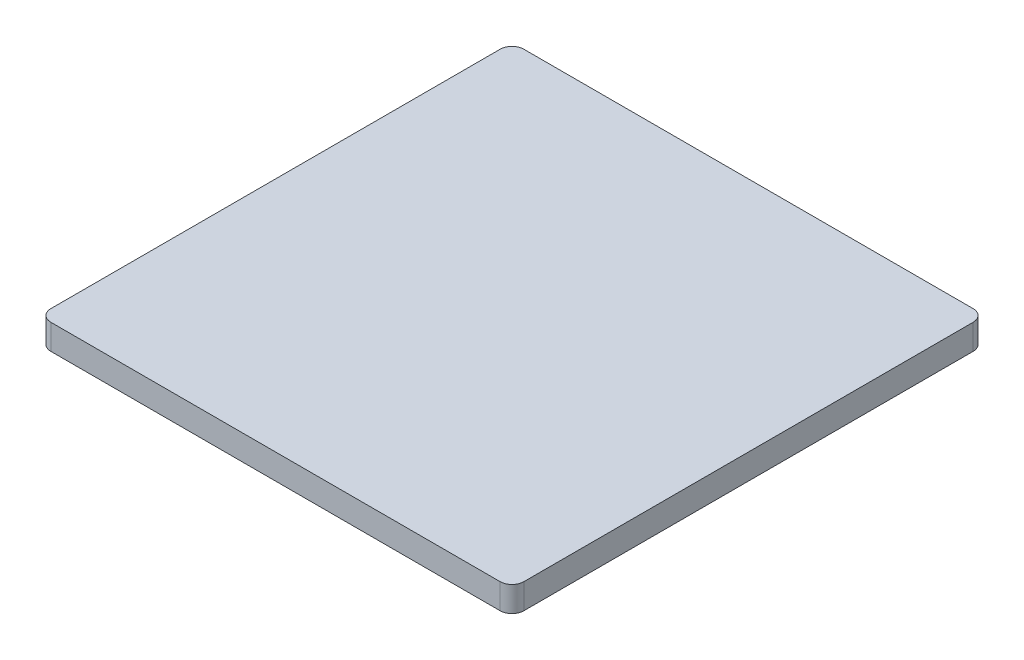
from build123d import *

# Parameters (mm, degrees)
SCHIZZO1_W                   = 30
SCHIZZO1_H                   = 30
ESTRUSIONE_ESTRUSIONE1_DEPTH = 1.6
RACCORDO1_R                  = 0.75


with BuildPart() as part:
    # Schizzo1 → Estrusione-Estrusione1 (new body)
    with BuildSketch(Plane(origin=(0, 0, 0), x_dir=(1, 0, 0), z_dir=(0, 1, 0))):
        with Locations((-40.4430411, -37.031161648)):
            Rectangle(SCHIZZO1_W, SCHIZZO1_H)
    extrude(amount=ESTRUSIONE_ESTRUSIONE1_DEPTH)

    # Raccordo1
    raccordo1_edges = [part.edges().sort_by_distance(p)[0] for p in [
        (-55.4430411, 0.8, 22.031161648),
        (-25.4430411, 0.8, 22.031161648),
        (-55.4430411, 0.8, 52.031161648),
        (-25.4430411, 0.8, 52.031161648),
    ]]
    fillet(raccordo1_edges, radius=RACCORDO1_R)


solid = part.part
